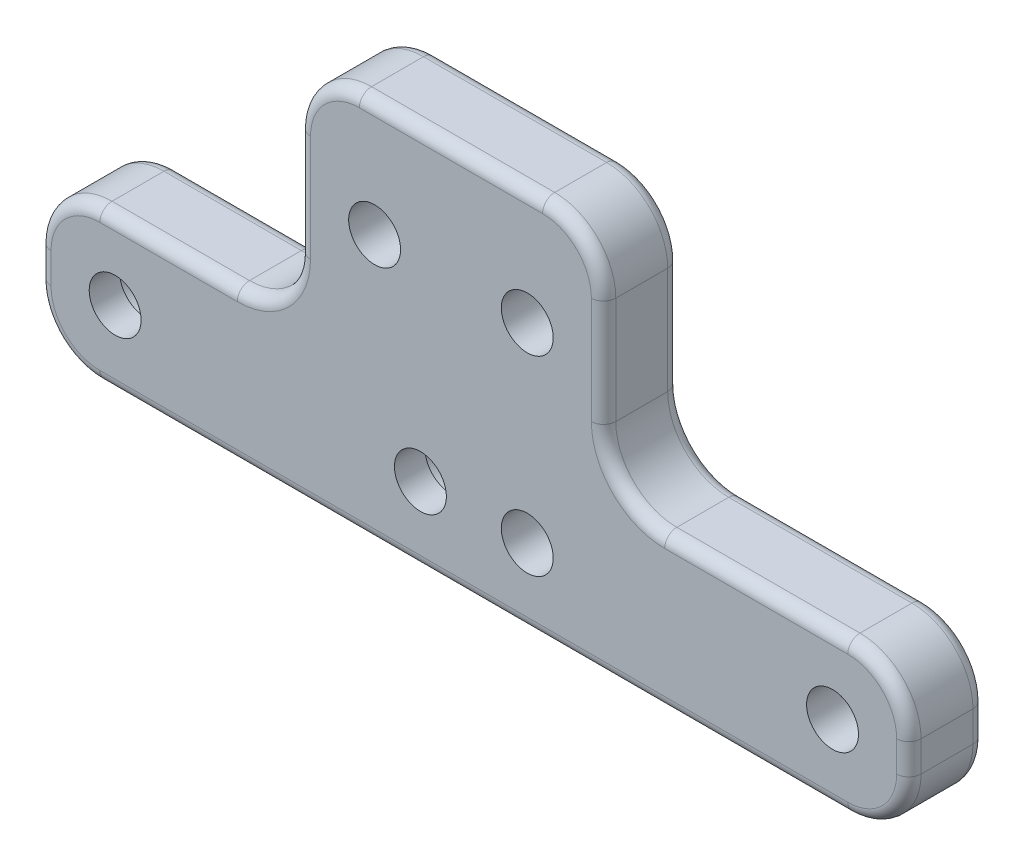
from build123d import *

# Parameters (mm, degrees)
SKETCH1_W                    = 20
SKETCH1_H                    = 15
SKETCH1_W_2                  = 40
SKETCH1_H_2                  = 10
BOSS_EXTRUDE1_DEPTH          = 5
M3_CLEARANCE_HOLE1_OUTLINE_R = 1.7
M3_CLEARANCE_HOLE1_DEPTH     = 5
SKETCH4_W                    = 17
SKETCH4_H                    = 10
BOSS_EXTRUDE2_DEPTH          = 5
HOLE1_OUTLINE_R              = 2.2
HOLE1_DEPTH                  = 3
HOLE1_START                  = 3
HOLE1_2_OUTLINE_R            = 1.7
HOLE1_2_DEPTH                = 2
FILLET1_R                    = 4
FILLET2_R                    = 0.8


# Read off the part's stored shape, not the designer's step: M3 Clearance Hole1, Hole1
with BuildPart() as part:
    # Sketch1 → Boss-Extrude1 (new body)
    with BuildSketch(Plane.XY):
        with Locations((10, 17.5)):
            Rectangle(SKETCH1_W, SKETCH1_H)
        with Locations((20, 5)):
            Rectangle(SKETCH1_W_2, SKETCH1_H_2)
    extrude(amount=BOSS_EXTRUDE1_DEPTH)

    # M3 Clearance Hole1 outline → M3 Clearance Hole1 (cut)
    with BuildSketch(Plane.XY):
        with Locations((5, 17.5)):
            Circle(M3_CLEARANCE_HOLE1_OUTLINE_R)
        with Locations((15, 17.5)):
            Circle(M3_CLEARANCE_HOLE1_OUTLINE_R)
        with Locations((15, 5)):
            Circle(M3_CLEARANCE_HOLE1_OUTLINE_R)
        with Locations((35, 5)):
            Circle(M3_CLEARANCE_HOLE1_OUTLINE_R)
    extrude(amount=M3_CLEARANCE_HOLE1_DEPTH, mode=Mode.SUBTRACT)

    # Sketch4 → Boss-Extrude2 (add)
    with BuildSketch(Plane.XY.offset(5)):
        with Locations((-8.5, 5)):
            Rectangle(SKETCH4_W, SKETCH4_H)
    extrude(amount=-BOSS_EXTRUDE2_DEPTH)

    # Hole1 outline → Hole1 (cut)
    with BuildSketch(Plane.XY):
        with Locations((8, 5)):
            Circle(HOLE1_OUTLINE_R)
        with Locations((-12, 5)):
            Circle(HOLE1_OUTLINE_R)
    extrude(amount=HOLE1_DEPTH, mode=Mode.SUBTRACT)

    # Hole1 2 outline → Hole1 2 (cut)
    with BuildSketch(Plane.XY.offset(HOLE1_START)):
        with Locations((8, 5)):
            Circle(HOLE1_2_OUTLINE_R)
        with Locations((-12, 5)):
            Circle(HOLE1_2_OUTLINE_R)
    extrude(amount=HOLE1_2_DEPTH, mode=Mode.SUBTRACT)

    # Fillet1
    fillet1_edges = [part.edges().sort_by_distance(p)[0] for p in [
        (0, 25, 2.5),
        (20, 25, 2.5),
        (20, 10, 2.5),
        (40, 10, 2.5),
        (40, 0, 2.5),
        (0, 10, 2.5),
        (-17, 0, 2.5),
        (-17, 10, 2.5),
    ]]
    fillet(fillet1_edges, radius=FILLET1_R)

    # Fillet2
    fillet2_edges = [part.edges().sort_by_distance(p)[0] for p in [
        (21.171572875, 11.171572875, 0),
        (21.171572875, 11.171572875, 5),
        (-1.171572875, 11.171572875, 5),
        (-1.171572875, 11.171572875, 0),
        (-17, 5, 0),
        (-17, 5, 5),
        (0, 17.5, 5),
        (-8.5, 10, 5),
        (11.5, 0, 5),
        (40, 5, 5),
        (30, 10, 5),
        (20, 17.5, 5),
        (10, 25, 5),
        (1.171572875, 23.828427125, 5),
        (18.828427125, 23.828427125, 5),
        (38.828427125, 8.828427125, 5),
        (38.828427125, 1.171572875, 5),
        (-15.828427125, 8.828427125, 5),
        (-15.828427125, 1.171572875, 5),
        (11.5, 0, 0),
        (-8.5, 10, 0),
        (0, 17.5, 0),
        (10, 25, 0),
        (20, 17.5, 0),
        (30, 10, 0),
        (40, 5, 0),
        (1.171572875, 23.828427125, 0),
        (18.828427125, 23.828427125, 0),
        (38.828427125, 8.828427125, 0),
        (38.828427125, 1.171572875, 0),
        (-15.828427125, 8.828427125, 0),
        (-15.828427125, 1.171572875, 0),
    ]]
    fillet(fillet2_edges, radius=FILLET2_R)


solid = part.part
